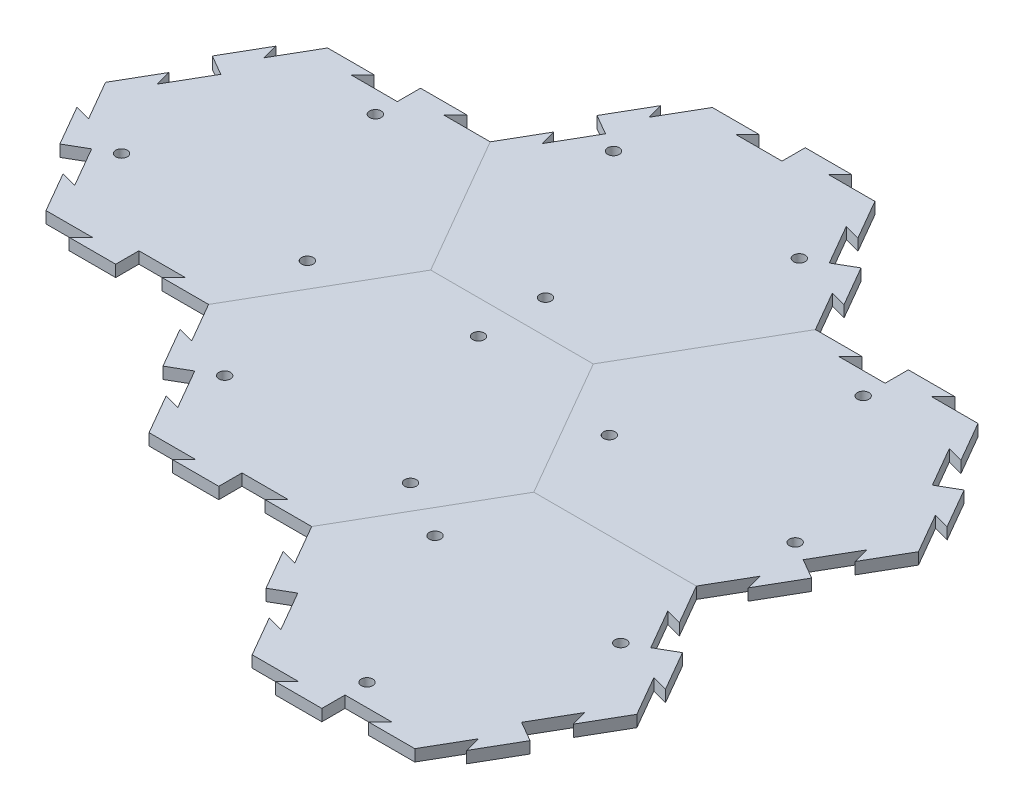
from build123d import *

# Parameters (mm, degrees)
BOSS_EXTRUDE1_DEPTH     = 6.35
SKETCH9_R               = 3.175
CUT_EXTRUDE3_DEPTH      = 118.774954893
CIRPATTERN6_COUNT       = 3
CUT_EXTRUDE2_DEPTH      = 271.453350876
BOSS_EXTRUDE3_DEPTH     = 6.35
CIRPATTERN3_COUNT       = 3
CIRPATTERN3_ANGLE       = 120
CIRPATTERN5_START       = -6.35
CIRPATTERN5_OUTLINE_R   = 3.175
CIRPATTERN5_DEPTH       = 6.35
CIRPATTERN5_2_OUTLINE_R = 3.175
CIRPATTERN5_2_DEPTH     = 6.35
CIRPATTERN5_3_OUTLINE_R = 3.175
CIRPATTERN5_3_DEPTH     = 6.35
BOSS_EXTRUDE4_DEPTH     = 6.35
CUT_EXTRUDE4_DEPTH      = 326.200985522
CIRPATTERN7_COUNT       = 2
CIRPATTERN7_ANGLE       = 60
CUT_EXTRUDE5_DEPTH      = 326.200985522
BOSS_EXTRUDE5_DEPTH     = 6.35
CUT_EXTRUDE6_DEPTH      = 326.200985522
BOSS_EXTRUDE6_DEPTH     = 6.35


# Read off the part's stored shape, not the designer's step: CirPattern5
with BuildPart() as part:
    # Sketch1 → Boss-Extrude1 (new body)
    with BuildSketch(Plane(origin=(0, 0, 0), x_dir=(1, 0, 0), z_dir=(0, 1, 0))):
        Polygon((88.9, 0), (44.45, 76.989658396), (-44.45, 76.989658396), (-88.9, 0), (-44.45, -76.989658396), (44.45, -76.989658396), align=None)
    extrude(amount=-BOSS_EXTRUDE1_DEPTH)

    # Sketch9 → Cut-Extrude3 (cut, through all)
    with BuildSketch(Plane(origin=(0, 0, 0), x_dir=(1, 0, 0), z_dir=(0, 1, 0))):
        with Locations(Location((-50.8, -29.329393675, 0), (0, 0, 270))):
            Circle(SKETCH9_R)
    cut_extrude3 = extrude(amount=-CUT_EXTRUDE3_DEPTH, mode=Mode.SUBTRACT)

    # CirPattern6: Cut-Extrude3 ×3 about axis
    cirpattern6_axis = Axis((0, 0, 0), (0, 1, 0))
    for i in range(1, CIRPATTERN6_COUNT):
        add(cut_extrude3.rotate(cirpattern6_axis, i * 360 / CIRPATTERN6_COUNT), mode=Mode.SUBTRACT)


with BuildPart() as body_2:
    # Mirror1: mirrored copy
    add(part.part.mirror(Plane(origin=(44.45, -6.35, 76.989658396), x_dir=(-0.49999999999999495, 0, 0.8660254037844416), z_dir=(0.8660254037844416, 0, 0.49999999999999495))))

    # Sketch5 → Cut-Extrude2 (cut, through all)
    with BuildSketch(Plane(origin=(0, 0, 0), x_dir=(1, 0, 0), z_dir=(0, 1, 0))):
        Polygon((190.5, -21.997045256), (181.825738686, -19.672783942), (194.525738686, -41.669829198), (200.025, -38.494829198), align=None)
    cut_extrude2 = extrude(amount=-CUT_EXTRUDE2_DEPTH, mode=Mode.SUBTRACT)

    # Sketch7 → Boss-Extrude3 (add)
    with BuildSketch(Plane(origin=(0, 0, 0), x_dir=(1, 0, 0), z_dir=(0, 1, 0))):
        Polygon((200.025, -38.494829198), (205.524261314, -35.319829198), (218.224261314, -57.316874454), (209.55, -54.99261314), align=None)
    boss_extrude3 = extrude(amount=-BOSS_EXTRUDE3_DEPTH)

    # CirPattern3: Cut-Extrude2, Boss-Extrude3 ×3 about axis
    cirpattern3_axis = Axis((133.35, 0, 76.989658396), (0, -1, 0))
    add([cut_extrude2.rotate(cirpattern3_axis, i * CIRPATTERN3_ANGLE / (CIRPATTERN3_COUNT - 1)) for i in range(1, CIRPATTERN3_COUNT)], mode=Mode.SUBTRACT)
    add([boss_extrude3.rotate(cirpattern3_axis, i * CIRPATTERN3_ANGLE / (CIRPATTERN3_COUNT - 1)) for i in range(1, CIRPATTERN3_COUNT)])

    # Sketch14 → Cut-Extrude6 (cut, through all)
    with BuildSketch(Plane(origin=(0, 0, 0), x_dir=(1, 0, 0), z_dir=(0, 1, 0))):
        Polygon((66.675, -115.484487595), (72.174261314, -112.309487595), (84.874261314, -134.306532851), (76.2, -131.982271537), align=None)
    extrude(amount=-CUT_EXTRUDE6_DEPTH, mode=Mode.SUBTRACT)

    # Sketch15 → Boss-Extrude6 (add)
    with BuildSketch(Plane(origin=(0, 0, 0), x_dir=(1, 0, 0), z_dir=(0, 1, 0))):
        Polygon((66.675, -115.484487595), (61.175738686, -118.659487595), (48.475738686, -96.662442339), (57.15, -98.986703653), align=None)
    extrude(amount=-BOSS_EXTRUDE6_DEPTH)


with BuildPart() as body_3:
    # CirPattern5 outline → CirPattern5 (new body)
    with BuildSketch(Plane(origin=(0, 0, 0), x_dir=(1, 0, 0), z_dir=(0, 1, 0)).offset(CIRPATTERN5_START)):
        Polygon((-44.45, 76.989658396), (-88.9, 153.979316793), (-114.3, 153.979316793), (-107.95, 160.329316793), (-133.35, 160.329316793), (-133.35, 147.629316793), (-158.75, 147.629316793), (-152.4, 153.979316793), (-177.8, 153.979316793), (-190.5, 131.982271537), (-192.824261314, 140.656532851), (-205.524261314, 118.659487595), (-194.525738686, 112.309487595), (-207.225738686, 90.312442339), (-209.55, 98.986703653), (-222.25, 76.989658396), (-209.55, 54.99261314), (-218.224261314, 57.316874454), (-205.524261314, 35.319829198), (-194.525738686, 41.669829198), (-181.825738686, 19.672783942), (-190.5, 21.997045256), (-177.8, 0), (-88.9, 0), align=None)
        with Locations((-184.15, 47.660264722)):
            Circle(CIRPATTERN5_OUTLINE_R, mode=Mode.SUBTRACT)
        with Locations((-82.55, 47.660264722)):
            Circle(CIRPATTERN5_OUTLINE_R, mode=Mode.SUBTRACT)
        with Locations((-133.35, 135.648445746)):
            Circle(CIRPATTERN5_OUTLINE_R, mode=Mode.SUBTRACT)
    extrude(amount=CIRPATTERN5_DEPTH)

    # Sketch12 → Cut-Extrude5 (cut, through all)
    with BuildSketch(Plane(origin=(0, 0, 0), x_dir=(1, 0, 0), z_dir=(0, 1, 0))):
        Polygon((-133.35, 0), (-133.35, 6.35), (-107.95, 6.35), (-114.3, 0), align=None)
    extrude(amount=-CUT_EXTRUDE5_DEPTH, mode=Mode.SUBTRACT)

    # Sketch13 → Boss-Extrude5 (add)
    with BuildSketch(Plane(origin=(0, 0, 0), x_dir=(1, 0, 0), z_dir=(0, 1, 0))):
        Polygon((-133.35, 0), (-133.35, -6.35), (-158.75, -6.35), (-152.4, 0), align=None)
    extrude(amount=-BOSS_EXTRUDE5_DEPTH)


with BuildPart() as body_4:
    # CirPattern5 2 outline → CirPattern5 2 (new body)
    with BuildSketch(Plane(origin=(0, 0, 0), x_dir=(1, 0, 0), z_dir=(0, 1, 0)).offset(CIRPATTERN5_START)):
        Polygon((44.45, 76.989658396), (88.9, 153.979316793), (76.2, 175.976362049), (84.874261314, 173.652100735), (72.174261314, 195.649145991), (61.175738686, 189.299145991), (48.475738686, 211.296191247), (57.15, 208.971929933), (44.45, 230.968975189), (19.05, 230.968975189), (25.4, 237.318975189), (0, 237.318975189), (0, 224.618975189), (-25.4, 224.618975189), (-19.05, 230.968975189), (-44.45, 230.968975189), (-57.15, 208.971929933), (-59.474261314, 217.646191247), (-72.174261314, 195.649145991), (-61.175738686, 189.299145991), (-73.875738686, 167.302100735), (-76.2, 175.976362049), (-88.9, 153.979316793), (-44.45, 76.989658396), align=None)
        with Locations((0, 95.320529443)):
            Circle(CIRPATTERN5_2_OUTLINE_R, mode=Mode.SUBTRACT)
        with Locations((-50.8, 183.308710468)):
            Circle(CIRPATTERN5_2_OUTLINE_R, mode=Mode.SUBTRACT)
        with Locations((50.8, 183.308710468)):
            Circle(CIRPATTERN5_2_OUTLINE_R, mode=Mode.SUBTRACT)
    extrude(amount=CIRPATTERN5_2_DEPTH)


with BuildPart() as body_5:
    # CirPattern5 3 outline → CirPattern5 3 (new body)
    with BuildSketch(Plane(origin=(0, 0, 0), x_dir=(1, 0, 0), z_dir=(0, 1, 0)).offset(CIRPATTERN5_START)):
        Polygon((88.9, 0), (177.8, 0), (190.5, 21.997045256), (192.824261314, 13.322783942), (205.524261314, 35.319829198), (194.525738686, 41.669829198), (207.225738686, 63.666874454), (209.55, 54.99261314), (222.25, 76.989658396), (209.55, 98.986703653), (218.224261314, 96.662442339), (205.524261314, 118.659487595), (194.525738686, 112.309487595), (181.825738686, 134.306532851), (190.5, 131.982271537), (177.8, 153.979316793), (152.4, 153.979316793), (158.75, 160.329316793), (133.35, 160.329316793), (133.35, 147.629316793), (107.95, 147.629316793), (114.3, 153.979316793), (88.9, 153.979316793), (44.45, 76.989658396), align=None)
        with Locations((82.55, 47.660264722)):
            Circle(CIRPATTERN5_3_OUTLINE_R, mode=Mode.SUBTRACT)
        with Locations((184.15, 47.660264722)):
            Circle(CIRPATTERN5_3_OUTLINE_R, mode=Mode.SUBTRACT)
        with Locations((133.35, 135.648445746)):
            Circle(CIRPATTERN5_3_OUTLINE_R, mode=Mode.SUBTRACT)
    extrude(amount=CIRPATTERN5_3_DEPTH)


with BuildPart() as part_1:
    add(part.part)

    # Sketch10 → Boss-Extrude4 (add)
    with BuildSketch(Plane(origin=(0, 0, 0), x_dir=(1, 0, 0), z_dir=(0, 1, 0))):
        Polygon((-76.2, -21.997045256), (-84.874261314, -19.672783942), (-72.174261314, -41.669829198), (-66.675, -38.494829198), align=None)
    boss_extrude4 = extrude(amount=-BOSS_EXTRUDE4_DEPTH)

    # Sketch11 → Cut-Extrude4 (cut, through all)
    with BuildSketch(Plane(origin=(0, 0, 0), x_dir=(1, 0, 0), z_dir=(0, 1, 0))):
        Polygon((-66.675, -38.494829198), (-61.175738686, -35.319829198), (-48.475738686, -57.316874454), (-57.15, -54.99261314), align=None)
    cut_extrude4 = extrude(amount=-CUT_EXTRUDE4_DEPTH, mode=Mode.SUBTRACT)

    # CirPattern7: Boss-Extrude4, Cut-Extrude4 ×2 about axis
    cirpattern7_axis = Axis((0, 0, 0), (0, 1, 0))
    add([boss_extrude4.rotate(cirpattern7_axis, i * CIRPATTERN7_ANGLE / (CIRPATTERN7_COUNT - 1)) for i in range(1, CIRPATTERN7_COUNT)])
    add([cut_extrude4.rotate(cirpattern7_axis, i * CIRPATTERN7_ANGLE / (CIRPATTERN7_COUNT - 1)) for i in range(1, CIRPATTERN7_COUNT)], mode=Mode.SUBTRACT)


solid = Compound([body_2.part, body_3.part, body_4.part, body_5.part, part_1.part])
